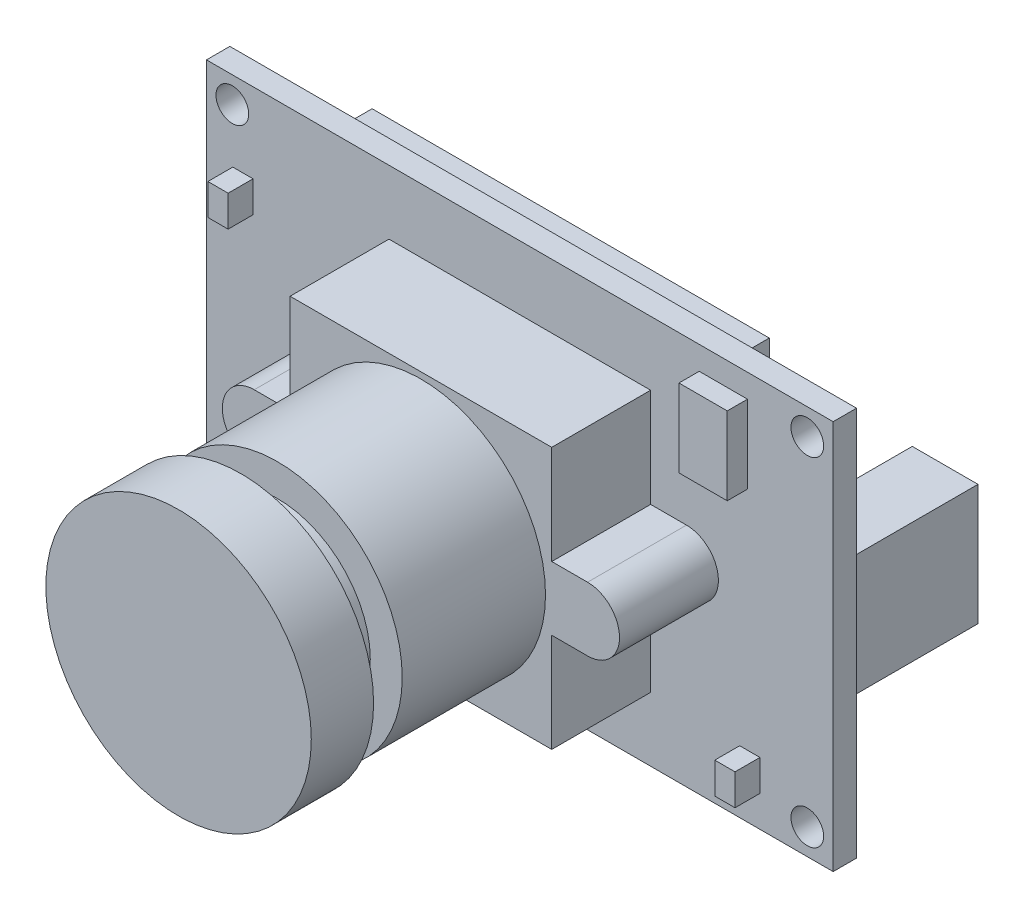
from build123d import *

# Parameters (mm, degrees)
SKETCH2_W            = 40.2336
SKETCH2_H            = 25.019
SKETCH2_R            = 1.05
BOSS_EXTRUDE1_DEPTH  = 1.5
BOSS_EXTRUDE2_DEPTH  = 6.35
SKETCH4_R            = 8
BOSS_EXTRUDE3_DEPTH  = 9.2
SKETCH5_R            = 5.95
BOSS_EXTRUDE4_DEPTH  = 2.36
SKETCH6_R            = 8.5217
LENS_DEPTH           = 4
SKETCH7_W            = 4.22
SKETCH7_H            = 7.75
BOSS_EXTRUDE6_DEPTH  = 8.3
SKETCH8_W            = 9
SKETCH8_H            = 2.93
BOSS_EXTRUDE7_DEPTH  = 4.35
SKETCH9_W            = 3.1
SKETCH9_H            = 5
BOSS_EXTRUDE8_DEPTH  = 1.3
SKETCH10_W           = 25.5
SKETCH10_H           = 8
BOSS_EXTRUDE9_DEPTH  = 1.4
SKETCH11_W           = 1.3
SKETCH11_H           = 2
BOSS_EXTRUDE10_DEPTH = 1.6
SKETCH12_W           = 3
SKETCH12_H           = 3
BOSS_EXTRUDE11_DEPTH = 1.4
SKETCH13_W           = 3.175
SKETCH13_H           = 2.6162
SKETCH13_W_2         = 8.509
SKETCH13_H_2         = 4.826
BOSS_EXTRUDE12_DEPTH = 2.7432


with BuildPart() as part:
    # Sketch2 → Boss-Extrude1 (new body)
    with BuildSketch(Plane.XY):
        Rectangle(SKETCH2_W, SKETCH2_H)
        with Locations((-18.4568, 10.8495)):
            Circle(SKETCH2_R, mode=Mode.SUBTRACT)
        with Locations((-18.4568, -10.8495)):
            Circle(SKETCH2_R, mode=Mode.SUBTRACT)
        with Locations((18.4568, -10.8495)):
            Circle(SKETCH2_R, mode=Mode.SUBTRACT)
        with Locations((18.4568, 10.8495)):
            Circle(SKETCH2_R, mode=Mode.SUBTRACT)
    extrude(amount=BOSS_EXTRUDE1_DEPTH)

    # Sketch3 → Boss-Extrude2 (add)
    with BuildSketch(Plane.XY.offset(1.5)):
        with BuildLine():
            Line((-8.4, -2.05), (-8.4, -8.4))
            Line((-8.4, -8.4), (8.4, -8.4))
            Line((8.4, -8.4), (8.4, -2.05))
            Line((8.4, -2.05), (10.7, -2.05))
            ThreePointArc((10.7, -2.05), (12.75, 0), (10.7, 2.05))
            Line((10.7, 2.05), (8.4, 2.05))
            Line((8.4, 2.05), (8.4, 8.4))
            Line((8.4, 8.4), (-8.4, 8.4))
            Line((-8.4, 8.4), (-8.4, 2.05))
            Line((-8.4, 2.05), (-10.7, 2.05))
            ThreePointArc((-10.7, 2.05), (-12.75, 0), (-10.7, -2.05))
            Line((-10.7, -2.05), (-8.4, -2.05))
        make_face()
    extrude(amount=BOSS_EXTRUDE2_DEPTH)

    # Sketch4 → Boss-Extrude3 (add)
    with BuildSketch(Plane.XY.offset(7.85)):
        Circle(SKETCH4_R)
    extrude(amount=BOSS_EXTRUDE3_DEPTH)

    # Sketch5 → Boss-Extrude4 (add)
    with BuildSketch(Plane.XY.offset(17.05)):
        Circle(SKETCH5_R)
    extrude(amount=BOSS_EXTRUDE4_DEPTH)

    # Sketch6 → Lens (add)
    with BuildSketch(Plane.XY.offset(19.41)):
        Circle(SKETCH6_R)
    extrude(amount=LENS_DEPTH)

    # Sketch7 → Boss-Extrude6 (add)
    with BuildSketch(Plane(origin=(0, 0, 0), x_dir=(-1, 0, 0), z_dir=(0, 0, -1))):
        with Locations((-17.5068, 0)):
            Rectangle(SKETCH7_W, SKETCH7_H)
    extrude(amount=BOSS_EXTRUDE6_DEPTH)

    # Sketch8 → Boss-Extrude7 (add)
    with BuildSketch(Plane(origin=(0, 0, 0), x_dir=(-1, 0, 0), z_dir=(0, 0, -1))):
        with Locations((11.1768, -9.4045)):
            Rectangle(SKETCH8_W, SKETCH8_H)
    extrude(amount=BOSS_EXTRUDE7_DEPTH)

    # Sketch9 → Boss-Extrude8 (add)
    with BuildSketch(Plane.XY.offset(1.5)):
        with Locations((13.0668, 8.5095)):
            Rectangle(SKETCH9_W, SKETCH9_H)
    extrude(amount=BOSS_EXTRUDE8_DEPTH)

    # Sketch10 → Boss-Extrude9 (add)
    with BuildSketch(Plane(origin=(0, 0, 0), x_dir=(-1, 0, 0), z_dir=(0, 0, -1))):
        with Locations((-0.3668, 8.2095)):
            Rectangle(SKETCH10_W, SKETCH10_H)
    extrude(amount=BOSS_EXTRUDE9_DEPTH)

    # Sketch11 → Boss-Extrude10 (add)
    with BuildSketch(Plane.XY.offset(1.5)):
        with Locations((14.7668, -9.5095)):
            Rectangle(SKETCH11_W, SKETCH11_H)
        with Locations((-17.777092667, 6.391636208)):
            Rectangle(SKETCH11_W, SKETCH11_H)
    extrude(amount=BOSS_EXTRUDE10_DEPTH)

    # Sketch12 → Boss-Extrude11 (add)
    with BuildSketch(Plane(origin=(0, 0, 0), x_dir=(-1, 0, 0), z_dir=(0, 0, -1))):
        with Locations((17.6168, 6.6095)):
            Rectangle(SKETCH12_W, SKETCH12_H)
    extrude(amount=BOSS_EXTRUDE11_DEPTH)

    # Sketch13 → Boss-Extrude12 (add)
    with BuildSketch(Plane(origin=(0, 0, 0), x_dir=(-1, 0, 0), z_dir=(0, 0, -1))):
        with Locations((-12.5603, -10.6934)):
            Rectangle(SKETCH13_W, SKETCH13_H)
        with Locations((-2.9083, -9.5885)):
            Rectangle(SKETCH13_W_2, SKETCH13_H_2)
    extrude(amount=BOSS_EXTRUDE12_DEPTH)


solid = part.part
